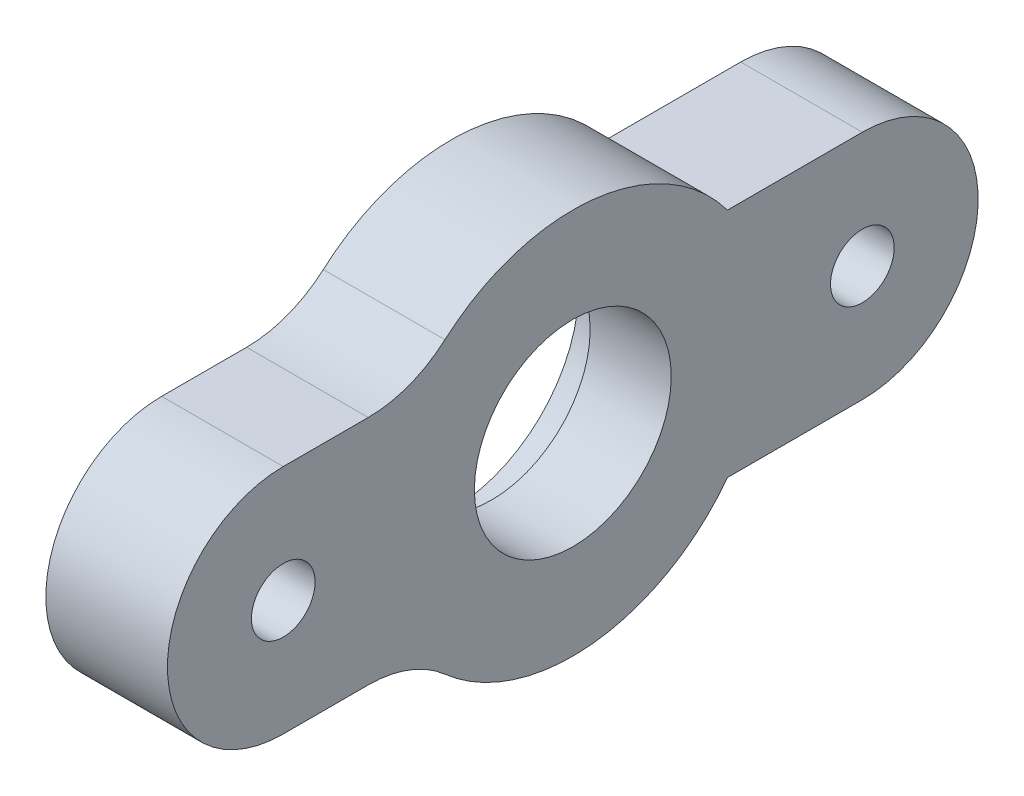
from build123d import *

# Parameters (mm, degrees)
AUFSATZ_LINEAR_START             = -10.5
AUFSATZ_LINEAR_AUSTRAGEN1_DEPTH  = 10.5
F_5_5_5_5_DURCHMESSER_BOHRUNG1_D = 5.5
VERRUNDUNG2_R                    = 10


with BuildPart() as part:
    # Skizze4 → Rotation1 (revolve)
    with BuildSketch(Plane.XY):
        Polygon((0, 11), (3.5, 11), (3.5, 8.5), (10.5, 8.5), (10.5, 16.683058648), (0, 16.683058648), align=None)
    revolve(axis=Axis((0, 0, 0), (1, 0, 0)))

    # Skizze5 → Aufsatz-Linear austragen1 (add)
    with BuildSketch(Plane(origin=(10.5, 0, 0), x_dir=(0, 0, -1), z_dir=(1, 0, 0)).offset(AUFSATZ_LINEAR_START)):
        with BuildLine():
            Line((-25, 10), (-13.35381765, 10))
            ThreePointArc((-13.35381765, 10), (-16.683058648, 0), (-13.35381765, -10))
            Line((-13.35381765, -10), (-25, -10))
            ThreePointArc((-25, -10), (-35, 0), (-25, 10))
        make_face()
    aufsatz_linear_austragen1 = extrude(amount=AUFSATZ_LINEAR_AUSTRAGEN1_DEPTH)

    # Ø5.5 (5.5) Durchmesser Bohrung1 (through all)
    with Locations(Plane(origin=(10.5, 0, 0), x_dir=(0, 0, -1), z_dir=(1, 0, 0))):
        with Locations((-25, 0)):
            f_5_5_5_5_durchmesser_bohrung1 = Hole(F_5_5_5_5_DURCHMESSER_BOHRUNG1_D / 2)

    # Spiegeln1: Aufsatz-Linear austragen1, Ø5.5 (5.5) Durchmesser Bohrung1 across plane
    add(aufsatz_linear_austragen1.mirror(Plane.XY))
    add(f_5_5_5_5_durchmesser_bohrung1.mirror(Plane.XY), mode=Mode.SUBTRACT)

    # Verrundung2
    verrundung2_edges = [part.edges().sort_by_distance(p)[0] for p in [
        (5.25, -10, 13.35381765),
        (5.25, 10, 13.35381765),
    ]]
    fillet(verrundung2_edges, radius=VERRUNDUNG2_R)


solid = part.part
